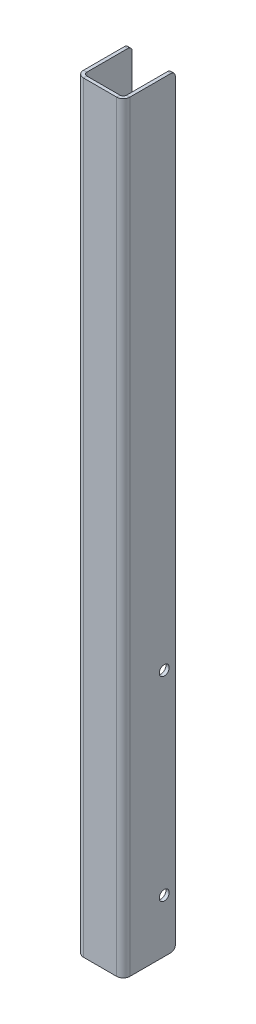
from build123d import *

# Parameters (mm, degrees)
SKETCH1_W                      = 57.15
SKETCH1_H                      = 1092.2
BASE_FLANGE1_DEPTH             = 4.7625
EDGE_FLANGE1_STRIP_W           = 28.575
EDGE_FLANGE1_STRIP_H           = 4.7625
EDGE_FLANGE1_STRIP_CUT_DEPTH   = 1092.2
EDGE_FLANGE1_STRIP_2_W         = 28.575
EDGE_FLANGE1_STRIP_2_H         = 4.7625
EDGE_FLANGE1_STRIP_CUT_2_DEPTH = 1092.2
EDGE_FLANGE1_DEPTH             = 1092.2
EDGE_FLANGE1_BEND_DEPTH        = 1092.2
F_1_2_CLEARANCE_HOLE1_D        = 14.2875
FILLET1_R                      = 6.35


# Sheet-metal steps are written as plain solids
with BuildPart() as part:
    # Sketch1 → Base-Flange1 (new body)
    with BuildSketch(Plane.XY):
        with Locations((0, 546.1)):
            Rectangle(SKETCH1_W, SKETCH1_H)
    extrude(amount=-BASE_FLANGE1_DEPTH)

    # Edge-Flange1 strip (across the edge) → Edge-Flange1 strip cut (cut)
    with BuildSketch(Plane(origin=(-28.575, 0, -4.7625), x_dir=(1, 0, 0), z_dir=(0, 1, 0))):
        with Locations((-9.525, -2.38125)):
            Rectangle(EDGE_FLANGE1_STRIP_W, EDGE_FLANGE1_STRIP_H)
    extrude(amount=EDGE_FLANGE1_STRIP_CUT_DEPTH, mode=Mode.SUBTRACT)

    # Edge-Flange1 strip 2 (across the edge) → Edge-Flange1 strip cut 2 (cut)
    with BuildSketch(Plane(origin=(28.575, 1092.2, -4.7625), x_dir=(-1, 0, 0), z_dir=(0, -1, 0))):
        with Locations((-9.525, -2.38125)):
            Rectangle(EDGE_FLANGE1_STRIP_2_W, EDGE_FLANGE1_STRIP_2_H)
    extrude(amount=EDGE_FLANGE1_STRIP_CUT_2_DEPTH, mode=Mode.SUBTRACT)

    # Edge-Flange1 section (across the edge) → Edge-Flange1 (add)
    with BuildSketch(Plane(origin=(-28.575, 0, -4.7625), x_dir=(1, 0, 0), z_dir=(0, 1, 0))):
        with BuildLine():
            Line((-4.7625, 4.7625), (-4.7625, 69.85))
            Line((-4.7625, 69.85), (0, 69.85))
            Line((0, 69.85), (0, 4.7625))
            ThreePointArc((0, 4.7625), (1.394903955, 1.394903955), (4.7625, 0))
            Line((4.7625, 0), (4.7625, -4.7625))
            ThreePointArc((4.7625, -4.7625), (-1.972692091, -1.972692091), (-4.7625, 4.7625))
        make_face()
    extrude(amount=EDGE_FLANGE1_DEPTH)

    # Edge-Flange1 section 2 (across the edge) → Edge-Flange1 bend (add)
    with BuildSketch(Plane(origin=(28.575, 1092.2, -4.7625), x_dir=(-1, 0, 0), z_dir=(0, -1, 0))):
        with BuildLine():
            Line((-4.7625, 4.7625), (-4.7625, 69.85))
            Line((-4.7625, 69.85), (0, 69.85))
            Line((0, 69.85), (0, 4.7625))
            ThreePointArc((0, 4.7625), (1.394903955, 1.394903955), (4.7625, 0))
            Line((4.7625, 0), (4.7625, -4.7625))
            ThreePointArc((4.7625, -4.7625), (-1.972692091, -1.972692091), (-4.7625, 4.7625))
        make_face()
    extrude(amount=EDGE_FLANGE1_BEND_DEPTH)

    # 1/2 Clearance Hole1 (through all)
    with Locations(Plane(origin=(33.3375, 0, 0), x_dir=(0, 0, -1), z_dir=(1, 0, 0))):
        with Locations((58.7375, 76.2), (58.7375, 355.6)):
            Hole(F_1_2_CLEARANCE_HOLE1_D / 2)

    # Fillet1
    fillet1_edges = [part.edges().sort_by_distance(p)[0] for p in [
        (-30.95625, 0, -74.6125),
        (-30.95625, 1092.2, -74.6125),
        (30.95625, 1092.2, -74.6125),
        (30.95625, 0, -74.6125),
    ]]
    fillet(fillet1_edges, radius=FILLET1_R)


solid = part.part
